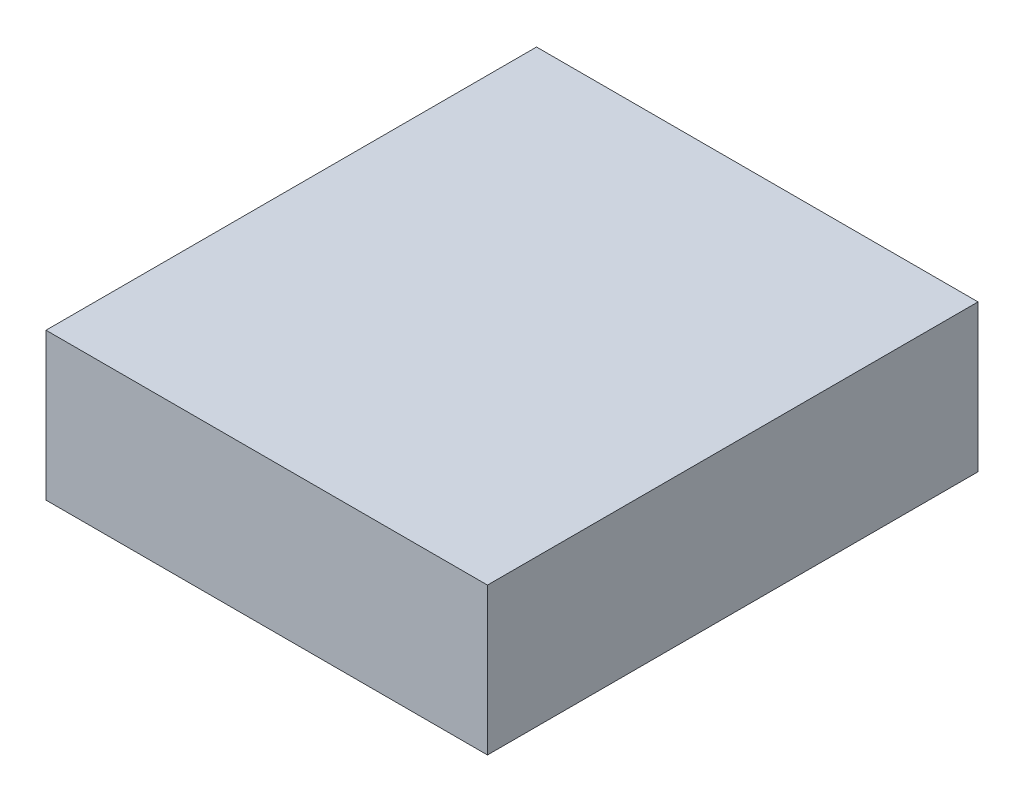
from build123d import *

# Parameters (mm, degrees)
ESBO_O1_W                = 100
ESBO_O1_H                = 30
RESSALTO_EXTRUS_O1_DEPTH = 90


with BuildPart() as part:
    # Esboço1 → Ressalto-extrusão1 (new body)
    with BuildSketch(Plane(origin=(0, 0, 0), x_dir=(0, 0, -1), z_dir=(1, 0, 0))):
        Rectangle(ESBO_O1_W, ESBO_O1_H)
    extrude(amount=RESSALTO_EXTRUS_O1_DEPTH)


solid = part.part
